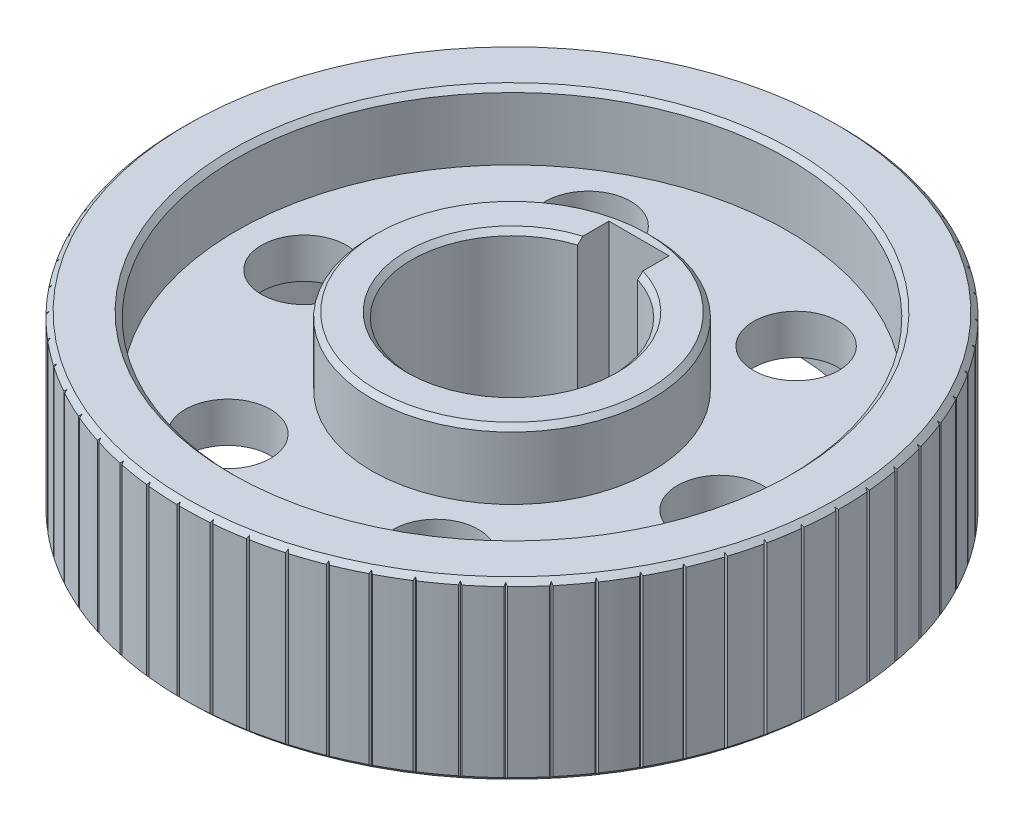
from build123d import *

# Parameters (mm, degrees)
SKETCH_2_R               = 65.7475
EXTRUDE_1_DEPTH          = 35
CUT_EXTRUDE_1_DEPTH      = 100.350226535
CUT_EXTRUDE_1_DEPTH_BACK = 100.350226535
CUT_EXTRUDE_START        = -13.5
SKETCH_3_6_R             = 55
SKETCH_3_6_R_2           = 8.5
SKETCH_3_6_R_3           = 28
CUT_EXTRUDE_2_DEPTH      = 113.850226535
CUT_EXTRUDE_3_DEPTH      = 100.350226535
CUT_EXTRUDE_3_DEPTH_BACK = 100.350226535
SKETCH_3_7_R             = 8.5
CHAMFER_2_SIZE           = 1
CUT_EXTRUDE_6_DEPTH      = 100.350226535
PATTERN_CIRCULAR_2_COUNT = 64


with BuildPart() as part:
    # 草图2 → 凸台-拉伸1 (new body)
    with BuildSketch(Plane(origin=(0, 0, 0), x_dir=(1, 0, 0), z_dir=(0, 1, 0))):
        Circle(SKETCH_2_R)
    extrude(amount=EXTRUDE_1_DEPTH)

    # 草图3 → 切除-拉伸1 (cut, two sides: drawn at the far end of the back side and taken through both)
    with BuildSketch(Plane(origin=(0, 35, 0), x_dir=(1, 0, 0), z_dir=(0, 1, 0)).offset(-CUT_EXTRUDE_1_DEPTH_BACK)):
        with BuildLine():
            Line((6, 25.337147023), (0, 25.337147023))
            Line((0, 25.337147023), (-6, 25.337147023))
            Line((-6, 25.337147023), (-6, 19.078784028))
            ThreePointArc((-6, 19.078784028), (0, -20), (6, 19.078784028))
            Line((6, 19.078784028), (6, 25.337147023))
        make_face()
    extrude(amount=CUT_EXTRUDE_1_DEPTH + CUT_EXTRUDE_1_DEPTH_BACK, mode=Mode.SUBTRACT)

    # 草图3<6> → 切除-拉伸2 (cut)
    with BuildSketch(Plane(origin=(0, 35, 0), x_dir=(1, 0, 0), z_dir=(0, 1, 0)).offset(CUT_EXTRUDE_START)):
        Circle(SKETCH_3_6_R)
        with Locations((-20.75, -35.940054257)):
            Circle(SKETCH_3_6_R_2, mode=Mode.SUBTRACT)
        with Locations((20.75, -35.940054257)):
            Circle(SKETCH_3_6_R_2, mode=Mode.SUBTRACT)
        with Locations((41.5, 0)):
            Circle(SKETCH_3_6_R_2, mode=Mode.SUBTRACT)
        with Locations((-41.5, 0)):
            Circle(SKETCH_3_6_R_2, mode=Mode.SUBTRACT)
        with Locations((-20.75, 35.940054257)):
            Circle(SKETCH_3_6_R_2, mode=Mode.SUBTRACT)
        Circle(SKETCH_3_6_R_3, mode=Mode.SUBTRACT)
        with Locations((20.75, 35.940054257)):
            Circle(SKETCH_3_6_R_2, mode=Mode.SUBTRACT)
    cut_extrude_2 = extrude(amount=CUT_EXTRUDE_2_DEPTH, mode=Mode.SUBTRACT)

    # 草图3<7> → 切除-拉伸3 (cut, two sides: drawn at the far end of the back side and taken through both)
    with BuildSketch(Plane(origin=(0, 35, 0), x_dir=(1, 0, 0), z_dir=(0, 1, 0)).offset(-CUT_EXTRUDE_3_DEPTH_BACK)):
        with Locations((-20.75, 35.940054257)):
            Circle(SKETCH_3_7_R)
        with Locations((20.75, 35.940054257)):
            Circle(SKETCH_3_7_R)
        with Locations((41.5, 0)):
            Circle(SKETCH_3_7_R)
        with Locations((20.75, -35.940054257)):
            Circle(SKETCH_3_7_R)
        with Locations((-20.75, -35.940054257)):
            Circle(SKETCH_3_7_R)
        with Locations((-41.5, 0)):
            Circle(SKETCH_3_7_R)
    extrude(amount=CUT_EXTRUDE_3_DEPTH + CUT_EXTRUDE_3_DEPTH_BACK, mode=Mode.SUBTRACT)

    # 镜向1: 切除-拉伸2 across plane
    add(cut_extrude_2.mirror(Plane.ZX.offset(17.5)), mode=Mode.SUBTRACT)

    # 倒角2
    chamfer_2_edges = [part.edges().sort_by_distance(p)[0] for p in [
        (0, 35, 20),
        (-28, 35, 0),
        (-55, 35, 0),
        (-65.7475, 35, 0),
        (-65.7475, 0, 0),
        (-28, 0, 0),
        (0, 0, 20),
        (-55, 0, 0),
    ]]
    chamfer(chamfer_2_edges, length=CHAMFER_2_SIZE)

    # 草图4 → 切除-拉伸6 (cut, through all)
    with BuildSketch(Plane(origin=(0, 35, 0), x_dir=(1, 0, 0), z_dir=(0, 1, 0))):
        with BuildLine():
            ThreePointArc((0.497222809, 65.998127015), (0.693534755, 65.655201766), (0.883404992, 65.308668363))
            ThreePointArc((0.883404992, 65.308668363), (1.082578891, 65.649939317), (1.288094548, 65.9874292))
            ThreePointArc((1.288094548, 65.9874292), (0.892674704, 65.993962844), (0.497222809, 65.998127015))
        make_face()
    cut_extrude_6 = extrude(amount=-CUT_EXTRUDE_6_DEPTH, mode=Mode.SUBTRACT)

    # 阵列(圆周)2: 切除-拉伸6 ×64 about axis
    pattern_circular_2_axis = Axis((0, 0, 0), (0, 1, 0))
    for i in range(1, PATTERN_CIRCULAR_2_COUNT):
        add(cut_extrude_6.rotate(pattern_circular_2_axis, i * 360 / PATTERN_CIRCULAR_2_COUNT), mode=Mode.SUBTRACT)


solid = part.part
